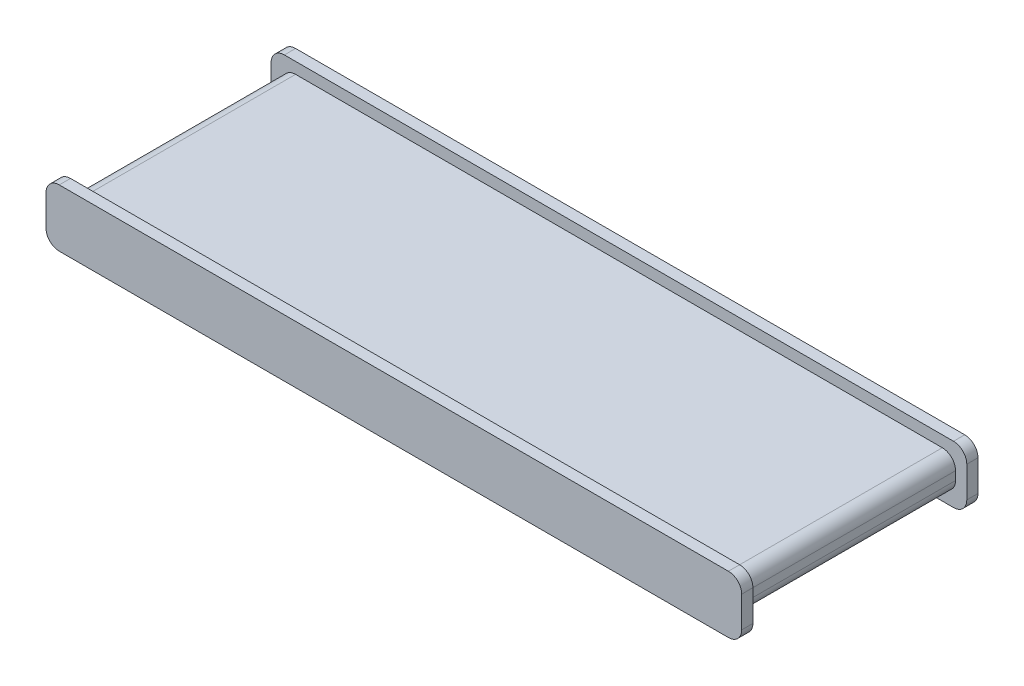
from build123d import *

# Parameters (mm, degrees)
SKETCH2_W           = 152.4
SKETCH2_H           = 7.924066875
BOSS_EXTRUDE1_DEPTH = 48.42
FILLET1_R           = 3
SKETCH3_W           = 157.48
SKETCH3_H           = 13.004066875
BOSS_EXTRUDE2_DEPTH = 2.54
SKETCH4_W           = 157.48
SKETCH4_H           = 13.004066875
BOSS_EXTRUDE3_DEPTH = 2.54
FILLET2_R           = 3


with BuildPart() as part:
    # Sketch2 → Boss-Extrude1 (new body)
    with BuildSketch(Plane.XY):
        with Locations((76.2, 3.962033438)):
            Rectangle(SKETCH2_W, SKETCH2_H)
    extrude(amount=BOSS_EXTRUDE1_DEPTH)

    # Fillet1
    fillet1_edges = [part.edges().sort_by_distance(p)[0] for p in [
        (152.4, 7.924066875, 24.21),
        (152.4, 0, 24.21),
        (0, 7.924066875, 24.21),
        (0, 0, 24.21),
    ]]
    fillet(fillet1_edges, radius=FILLET1_R)

    # Sketch3 → Boss-Extrude2 (add)
    with BuildSketch(Plane.XY.offset(48.42)):
        with Locations((76.2, 3.962033438)):
            Rectangle(SKETCH3_W, SKETCH3_H)
    extrude(amount=BOSS_EXTRUDE2_DEPTH)

    # Sketch4 → Boss-Extrude3 (add)
    with BuildSketch(Plane(origin=(0, 0, 0), x_dir=(-1, 0, 0), z_dir=(0, 0, -1))):
        with Locations((-76.2, 3.962033438)):
            Rectangle(SKETCH4_W, SKETCH4_H)
    extrude(amount=BOSS_EXTRUDE3_DEPTH)

    # Fillet2
    fillet2_edges = [part.edges().sort_by_distance(p)[0] for p in [
        (-2.54, -2.54, -1.27),
        (-2.54, 10.464066875, -1.27),
        (154.94, 10.464066875, -1.27),
        (154.94, -2.54, -1.27),
        (154.94, 10.464066875, 49.69),
        (154.94, -2.54, 49.69),
        (-2.54, 10.464066875, 49.69),
        (-2.54, -2.54, 49.69),
    ]]
    fillet(fillet2_edges, radius=FILLET2_R)


solid = part.part
